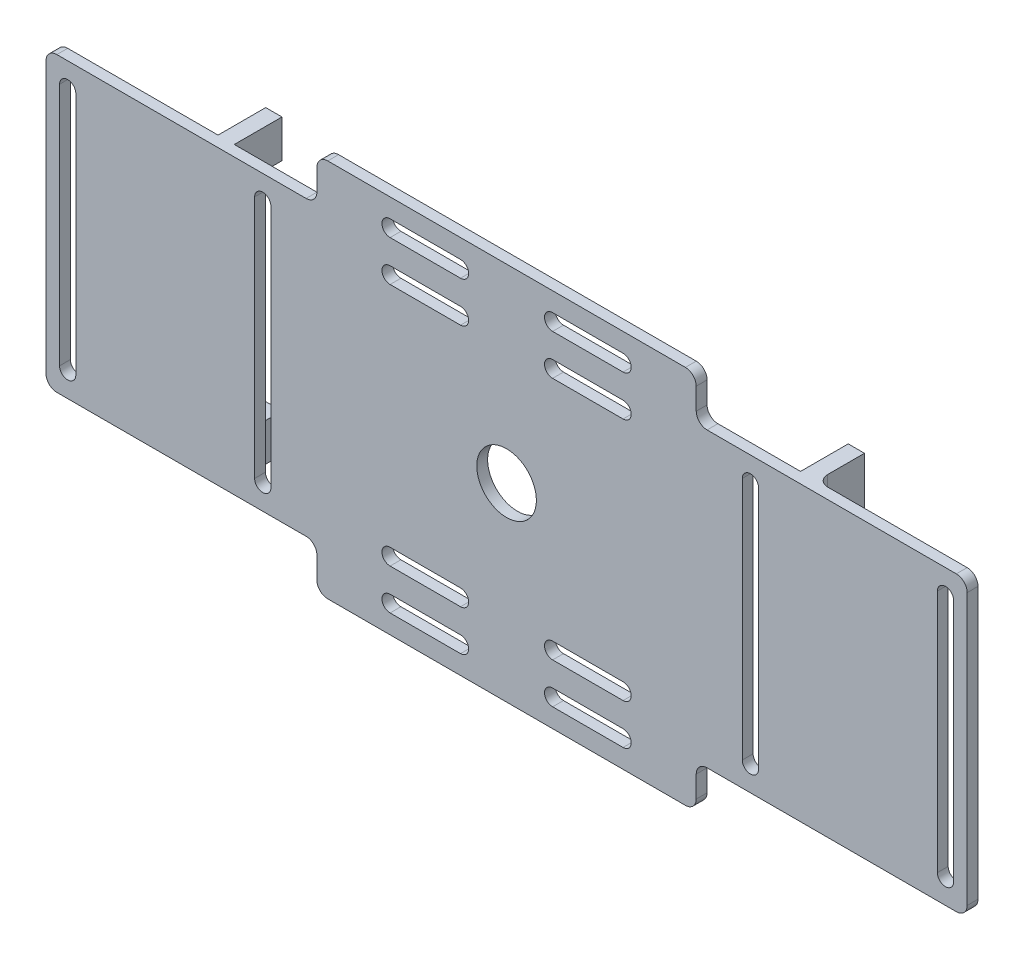
from build123d import *

# Parameters (mm, degrees)
SKETCH_1_W          = 170
SKETCH_1_H          = 70
EXTRUDE_1_DEPTH     = 2
SKETCH_2_R          = 5.5
CUT_EXTRUDE_1_DEPTH = 92.945636112
CUT_EXTRUDE_2_DEPTH = 92.945636112
SKETCH_5_W          = 3
SKETCH_5_H          = 54
EXTRUDE_2_DEPTH     = 10.8
FILLET_1_R          = 2
SKETCH_6_W          = 3
SKETCH_6_H          = 40
CUT_EXTRUDE_3_DEPTH = 6
FILLET_2_R          = 2


with BuildPart() as part:
    # 草圖1 → 填料-伸長1 (new body)
    with BuildSketch(Plane.XY):
        Rectangle(SKETCH_1_W, SKETCH_1_H)
    extrude(amount=EXTRUDE_1_DEPTH)

    # 草圖2 → 除料-伸長1 (cut, through all)
    with BuildSketch(Plane.XY.offset(2)):
        Circle(SKETCH_2_R)
        with BuildLine():
            Line((43.5, -22.5), (43.5, 22.5))
            ThreePointArc((43.5, 22.5), (45, 24), (46.5, 22.5))
            Line((46.5, 22.5), (46.5, -22.5))
            ThreePointArc((46.5, -22.5), (45, -24), (43.5, -22.5))
        make_face()
        with BuildLine():
            Line((-46.5, -22.5), (-46.5, 22.5))
            ThreePointArc((-46.5, 22.5), (-45, 24), (-43.5, 22.5))
            Line((-43.5, 22.5), (-43.5, -22.5))
            ThreePointArc((-43.5, -22.5), (-45, -24), (-46.5, -22.5))
        make_face()
        with BuildLine():
            Line((21.5, 28.5), (8.5, 28.5))
            ThreePointArc((8.5, 28.5), (7, 30), (8.5, 31.5))
            Line((8.5, 31.5), (21.5, 31.5))
            ThreePointArc((21.5, 31.5), (23, 30), (21.5, 28.5))
        make_face()
        with BuildLine():
            Line((-82.5, -22.5), (-82.5, 22.5))
            ThreePointArc((-82.5, 22.5), (-81, 24), (-79.5, 22.5))
            Line((-79.5, 22.5), (-79.5, -22.5))
            ThreePointArc((-79.5, -22.5), (-81, -24), (-82.5, -22.5))
        make_face()
        with BuildLine():
            Line((79.5, -22.5), (79.5, 22.5))
            ThreePointArc((79.5, 22.5), (81, 24), (82.5, 22.5))
            Line((82.5, 22.5), (82.5, -22.5))
            ThreePointArc((82.5, -22.5), (81, -24), (79.5, -22.5))
        make_face()
        with BuildLine():
            Line((21.5, 21), (8.5, 21))
            ThreePointArc((8.5, 21), (7, 22.5), (8.5, 24))
            Line((8.5, 24), (21.5, 24))
            ThreePointArc((21.5, 24), (23, 22.5), (21.5, 21))
        make_face()
        with BuildLine():
            Line((-21.5, 28.5), (-8.5, 28.5))
            ThreePointArc((-8.5, 28.5), (-7, 30), (-8.5, 31.5))
            Line((-8.5, 31.5), (-21.5, 31.5))
            ThreePointArc((-21.5, 31.5), (-23, 30), (-21.5, 28.5))
        make_face()
        with BuildLine():
            Line((-21.5, 21), (-8.5, 21))
            ThreePointArc((-8.5, 21), (-7, 22.5), (-8.5, 24))
            Line((-8.5, 24), (-21.5, 24))
            ThreePointArc((-21.5, 24), (-23, 22.5), (-21.5, 21))
        make_face()
        with BuildLine():
            Line((21.5, -28.5), (8.5, -28.5))
            ThreePointArc((8.5, -28.5), (7, -30), (8.5, -31.5))
            Line((8.5, -31.5), (21.5, -31.5))
            ThreePointArc((21.5, -31.5), (23, -30), (21.5, -28.5))
        make_face()
        with BuildLine():
            Line((21.5, -21), (8.5, -21))
            ThreePointArc((8.5, -21), (7, -22.5), (8.5, -24))
            Line((8.5, -24), (21.5, -24))
            ThreePointArc((21.5, -24), (23, -22.5), (21.5, -21))
        make_face()
        with BuildLine():
            Line((-21.5, -28.5), (-8.5, -28.5))
            ThreePointArc((-8.5, -28.5), (-7, -30), (-8.5, -31.5))
            Line((-8.5, -31.5), (-21.5, -31.5))
            ThreePointArc((-21.5, -31.5), (-23, -30), (-21.5, -28.5))
        make_face()
        with BuildLine():
            Line((-21.5, -21), (-8.5, -21))
            ThreePointArc((-8.5, -21), (-7, -22.5), (-8.5, -24))
            Line((-8.5, -24), (-21.5, -24))
            ThreePointArc((-21.5, -24), (-23, -22.5), (-21.5, -21))
        make_face()
    extrude(amount=-CUT_EXTRUDE_1_DEPTH, mode=Mode.SUBTRACT)

    # 草圖4 → 除料-伸長2 (cut, through all)
    with BuildSketch(Plane.XY.offset(2)):
        with BuildLine():
            Line((85, 35), (33, 35))
            ThreePointArc((33, 35), (34.414213562, 34.414213562), (35, 33))
            Line((35, 33), (35, 29))
            ThreePointArc((35, 29), (35.585786438, 27.585786438), (37, 27))
            Line((37, 27), (83, 27))
            ThreePointArc((83, 27), (84.414213562, 26.414213562), (85, 25))
            Line((85, 25), (85, 35))
        make_face()
        with BuildLine():
            Line((35, -33), (35, -29))
            ThreePointArc((35, -29), (35.585786438, -27.585786438), (37, -27))
            Line((37, -27), (83, -27))
            ThreePointArc((83, -27), (84.414213562, -26.414213562), (85, -25))
            Line((85, -25), (85, -35))
            Line((85, -35), (33, -35))
            ThreePointArc((33, -35), (34.414213562, -34.414213562), (35, -33))
        make_face()
        with BuildLine():
            Line((-85, -35), (-33, -35))
            ThreePointArc((-33, -35), (-34.414213562, -34.414213562), (-35, -33))
            Line((-35, -33), (-35, -29))
            ThreePointArc((-35, -29), (-35.585786438, -27.585786438), (-37, -27))
            Line((-37, -27), (-83, -27))
            ThreePointArc((-83, -27), (-84.414213562, -26.414213562), (-85, -25))
            Line((-85, -25), (-85, -35))
        make_face()
        with BuildLine():
            Line((-35, 33), (-35, 29))
            ThreePointArc((-35, 29), (-35.585786438, 27.585786438), (-37, 27))
            Line((-37, 27), (-83, 27))
            ThreePointArc((-83, 27), (-84.414213562, 26.414213562), (-85, 25))
            Line((-85, 25), (-85, 35))
            Line((-85, 35), (-33, 35))
            ThreePointArc((-33, 35), (-34.414213562, 34.414213562), (-35, 33))
        make_face()
    extrude(amount=-CUT_EXTRUDE_2_DEPTH, mode=Mode.SUBTRACT)

    # 草圖5 → 填料-伸長2 (add)
    with BuildSketch(Plane.XY.offset(2)):
        with Locations((-53.75, 0)):
            Rectangle(SKETCH_5_W, SKETCH_5_H)
        with Locations((53.75, 0)):
            Rectangle(SKETCH_5_W, SKETCH_5_H)
    extrude(amount=-EXTRUDE_2_DEPTH)

    # 圓角1
    fillet_1_edges = [part.edges().sort_by_distance(p)[0] for p in [
        (55.25, 0, 0),
    ]]
    fillet(fillet_1_edges, radius=FILLET_1_R)

    # 草圖6 → 除料-伸長3 (cut)
    with BuildSketch(Plane(origin=(0, 0, -8.8), x_dir=(-1, 0, 0), z_dir=(0, 0, -1))):
        with Locations((53.75, 0)):
            Rectangle(SKETCH_6_W, SKETCH_6_H)
    extrude(amount=-CUT_EXTRUDE_3_DEPTH, mode=Mode.SUBTRACT)

    # 圓角2
    fillet_2_edges = [part.edges().sort_by_distance(p)[0] for p in [
        (-53.75, -20, -2.8),
        (-53.75, 20, -2.8),
    ]]
    fillet(fillet_2_edges, radius=FILLET_2_R)


solid = part.part
